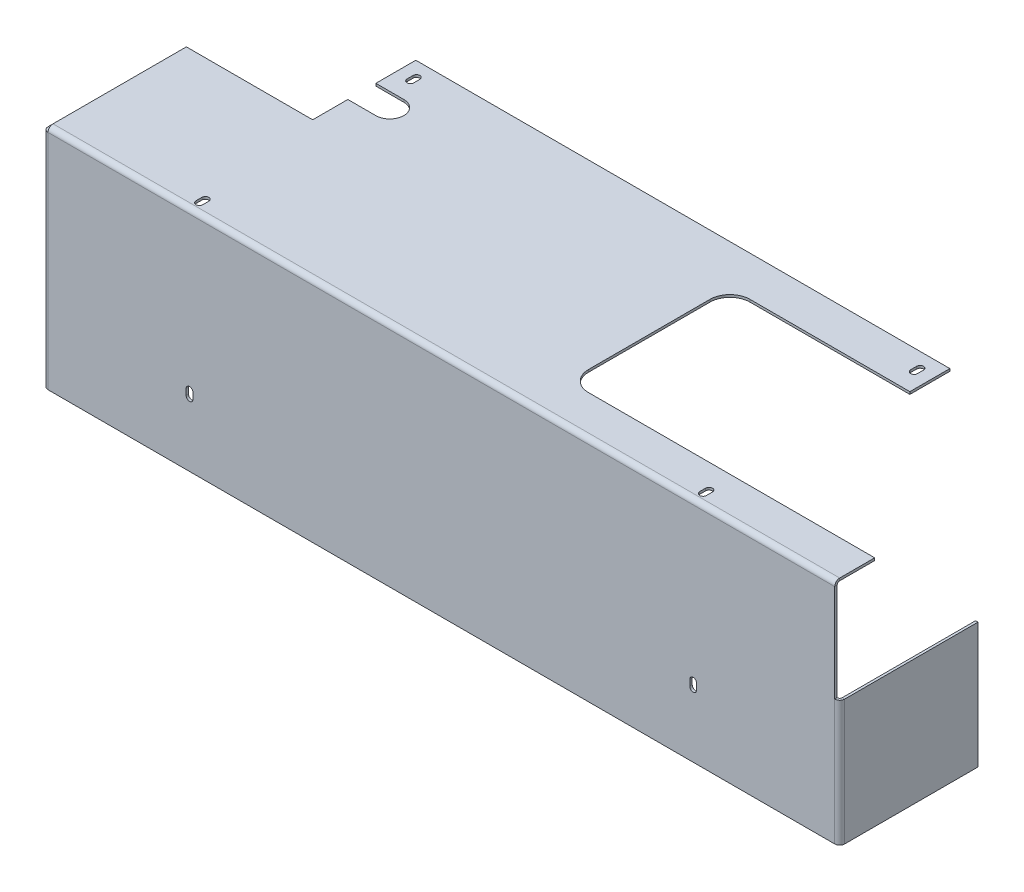
from build123d import *

# Parameters (mm, degrees)
BASE_FLANGE1_DEPTH           = 3.03784
EDGE_FLANGE1_STRIP_W         = 18.50136
EDGE_FLANGE1_STRIP_H         = 3.03784
EDGE_FLANGE1_STRIP_CUT_DEPTH = 984
EDGE_FLANGE1_DEPTH           = 984
EDGE_FLANGE2_DEPTH           = 278.78716
EDGE_FLANGE2_BEND_DEPTH      = 156.962160064
CUT_EXTRUDE1_DEPTH           = 594.499817979
CUT_EXTRUDE2_DEPTH           = 594.499817979
M6_START                     = -3.03784
M6_CLEARANCE_SLOT1_DEPTH     = 3.03784
M6_START_2                   = 147.96216
M6_CLEARANCE_SLOT2_DEPTH     = 3.03784


# Read off the part's stored shape, not the designer's step: M6 Clearance Slot1, M6 Clearance Slot2
# Sheet-metal steps are written as plain solids
with BuildPart() as part:
    # Sketch1 → Base-Flange1 (new body)
    with BuildSketch(Plane(origin=(0, 0, 0), x_dir=(1, 0, 0), z_dir=(0, 1, 0))):
        Polygon((334, 151), (-334, 151), (-334, 22), (-492, 22), (-492, -151), (334, -151), (492, -151), (492, 22), (334, 22), align=None)
    extrude(amount=-BASE_FLANGE1_DEPTH)

    # Edge-Flange1 strip (across the edge) → Edge-Flange1 strip cut (cut)
    with BuildSketch(Plane(origin=(492, -3.03784, 151), x_dir=(0, 0, -1), z_dir=(-1, 0, 0))):
        with Locations((-3.03784, -1.51892)):
            Rectangle(EDGE_FLANGE1_STRIP_W, EDGE_FLANGE1_STRIP_H)
    extrude(amount=EDGE_FLANGE1_STRIP_CUT_DEPTH, mode=Mode.SUBTRACT)

    # Edge-Flange1 section (across the edge) → Edge-Flange1 (add)
    with BuildSketch(Plane(origin=(492, -3.03784, 151), x_dir=(0, 0, -1), z_dir=(-1, 0, 0))):
        with BuildLine():
            Line((0, 3.175), (0, 281.96216))
            Line((0, 281.96216), (3.03784, 281.96216))
            Line((3.03784, 281.96216), (3.03784, 3.175))
            ThreePointArc((3.03784, 3.175), (3.96777597, 0.92993597), (6.21284, 0))
            Line((6.21284, 0), (6.21284, -3.03784))
            ThreePointArc((6.21284, -3.03784), (1.819698706, -1.218141294), (0, 3.175))
        make_face()
    extrude(amount=EDGE_FLANGE1_DEPTH)

    # Edge-Flange2 section (across the edge) → Edge-Flange2 (add)
    with BuildSketch(Plane(origin=(-495.175, -285, 147.96216), x_dir=(1, 0, 0), z_dir=(0, 1, 0))):
        with BuildLine():
            Line((-3.03784, 3.175), (-3.03784, 169.96216))
            Line((-3.03784, 169.96216), (0, 169.96216))
            Line((0, 169.96216), (0, 3.175))
            ThreePointArc((0, 3.175), (0.92993597, 0.92993597), (3.175, 0))
            Line((3.175, 0), (3.175, -3.03784))
            ThreePointArc((3.175, -3.03784), (-1.218141294, -1.218141294), (-3.03784, 3.175))
        make_face()
    extrude(amount=EDGE_FLANGE2_DEPTH)

    # Edge-Flange2 section 2 (across the edge) → Edge-Flange2 bend (add)
    with BuildSketch(Plane(origin=(495.175, -128.037839936, 147.96216), x_dir=(-1, 0, 0), z_dir=(0, -1, 0))):
        with BuildLine():
            Line((-3.03784, 3.175), (-3.03784, 169.96216))
            Line((-3.03784, 169.96216), (0, 169.96216))
            Line((0, 169.96216), (0, 3.175))
            ThreePointArc((0, 3.175), (0.92993597, 0.92993597), (3.175, 0))
            Line((3.175, 0), (3.175, -3.03784))
            ThreePointArc((3.175, -3.03784), (-1.218141294, -1.218141294), (-3.03784, 3.175))
        make_face()
    extrude(amount=EDGE_FLANGE2_BEND_DEPTH)

    # Sketch15 → Cut-Extrude1 (cut, through all)
    with BuildSketch(Plane(origin=(0, 0, 0), x_dir=(1, 0, 0), z_dir=(0, 1, 0))):
        with BuildLine():
            Line((492, 100.999999924), (134, 100.999999924))
            ThreePointArc((134, 100.999999924), (116.32233047, 93.677669454), (109, 75.999999924))
            Line((109, 75.999999924), (109, -76))
            ThreePointArc((109, -76), (116.32233047, -93.67766953), (134, -101))
            Line((134, -101), (492, -101))
            Line((492, -101), (492, 100.999999924))
        make_face()
    extrude(amount=-CUT_EXTRUDE1_DEPTH, mode=Mode.SUBTRACT)

    # Sketch16 → Cut-Extrude2 (cut, through all)
    with BuildSketch(Plane(origin=(0, 0, 0), x_dir=(1, 0, 0), z_dir=(0, 1, 0))):
        with BuildLine():
            Line((-334, 101), (-299, 101))
            ThreePointArc((-299, 101), (-281.5, 83.5), (-299, 66))
            Line((-299, 66), (-334, 66))
            Line((-334, 66), (-334, 101))
        make_face()
    extrude(amount=-CUT_EXTRUDE2_DEPTH, mode=Mode.SUBTRACT)

    # M6 Clearance Slot1 outline → M6 Clearance Slot1 (cut)
    with BuildSketch(Plane(origin=(0, 0, 0), x_dir=(1, 0, 0), z_dir=(0, 1, 0)).offset(M6_START)):
        with BuildLine():
            Line((319.25, 125.287839814), (319.25, 132.787839814))
            ThreePointArc((319.25, 132.787839814), (315, 137.037839814), (310.75, 132.787839814))
            Line((310.75, 132.787839814), (310.75, 125.287839814))
            ThreePointArc((310.75, 125.287839814), (315, 121.037839814), (319.25, 125.287839814))
        make_face()
        with BuildLine():
            ThreePointArc((319.25, -131.212160186), (315, -126.962160186), (310.75, -131.212160186))
            Line((310.75, -131.212160186), (310.75, -138.712160186))
            ThreePointArc((310.75, -138.712160186), (315, -142.962160186), (319.25, -138.712160186))
            Line((319.25, -138.712160186), (319.25, -131.212160186))
        make_face()
        with BuildLine():
            ThreePointArc((-310.75, -131.212160186), (-315, -126.962160186), (-319.25, -131.212160186))
            Line((-319.25, -131.212160186), (-319.25, -138.712160186))
            ThreePointArc((-319.25, -138.712160186), (-315, -142.962160186), (-310.75, -138.712160186))
            Line((-310.75, -138.712160186), (-310.75, -131.212160186))
        make_face()
        with BuildLine():
            ThreePointArc((-310.75, 132.787839814), (-315, 137.037839814), (-319.25, 132.787839814))
            Line((-319.25, 132.787839814), (-319.25, 125.287839814))
            ThreePointArc((-319.25, 125.287839814), (-315, 121.037839814), (-310.75, 125.287839814))
            Line((-310.75, 125.287839814), (-310.75, 132.787839814))
        make_face()
    extrude(amount=M6_CLEARANCE_SLOT1_DEPTH, mode=Mode.SUBTRACT)

    # M6 Clearance Slot2 outline → M6 Clearance Slot2 (cut)
    with BuildSketch(Plane.XY.offset(M6_START_2)):
        with BuildLine():
            ThreePointArc((319.250000047, -197.28784), (315.000000047, -193.03784), (310.750000047, -197.28784))
            Line((310.750000047, -197.28784), (310.750000047, -204.78784))
            ThreePointArc((310.750000047, -204.78784), (315.000000047, -209.03784), (319.250000047, -204.78784))
            Line((319.250000047, -204.78784), (319.250000047, -197.28784))
        make_face()
        with BuildLine():
            ThreePointArc((-310.750000047, -197.28784), (-315.000000047, -193.03784), (-319.250000047, -197.28784))
            Line((-319.250000047, -197.28784), (-319.250000047, -204.78784))
            ThreePointArc((-319.250000047, -204.78784), (-315.000000047, -209.03784), (-310.750000047, -204.78784))
            Line((-310.750000047, -204.78784), (-310.750000047, -197.28784))
        make_face()
    extrude(amount=M6_CLEARANCE_SLOT2_DEPTH, mode=Mode.SUBTRACT)


solid = part.part
